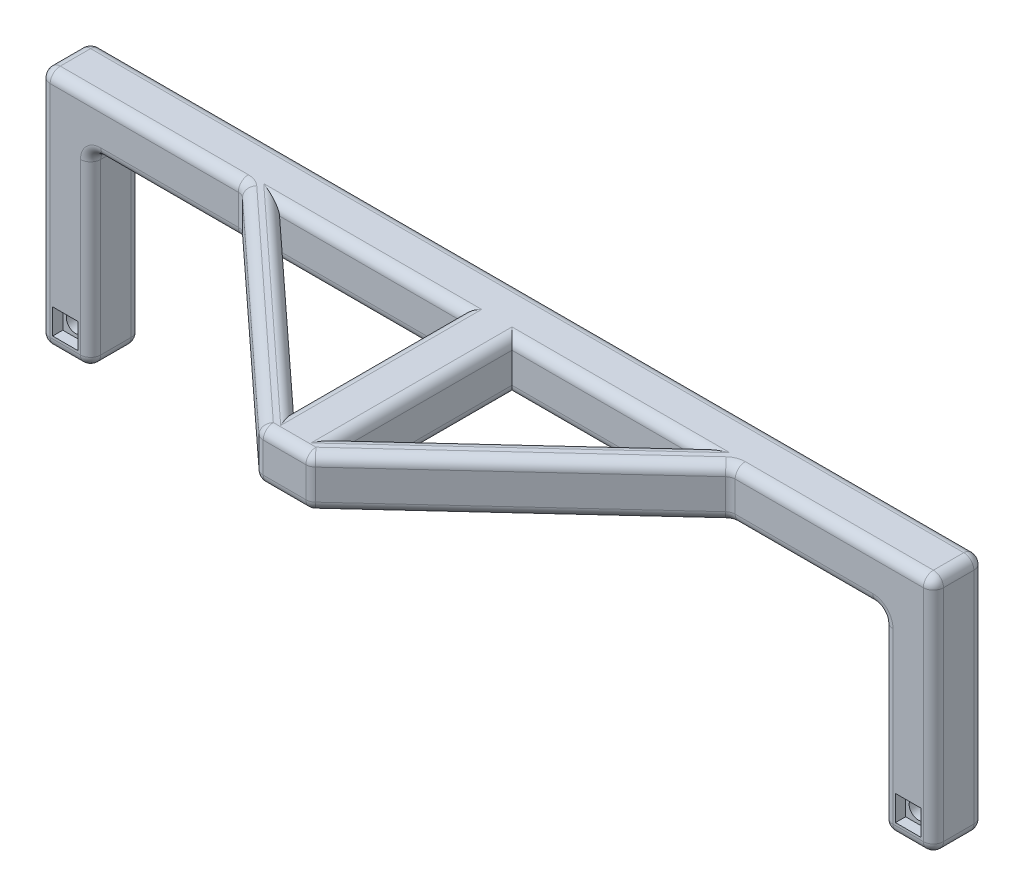
from build123d import *

# Parameters (mm, degrees)
SKETCH1_W           = 224.4725
SKETCH1_H           = 12.7
BOSS_EXTRUDE1_DEPTH = 12.7
SKETCH2_W           = 12.7
SKETCH2_H           = 12.7
BOSS_EXTRUDE2_DEPTH = 47.625
SKETCH3_R           = 2.286
CUT_EXTRUDE1_DEPTH  = 230.820220784
SKETCH4_W           = 6.35
SKETCH4_H           = 6.35
CUT_EXTRUDE2_DEPTH  = 2.54
BOSS_EXTRUDE3_DEPTH = 12.7
CUT_EXTRUDE4_DEPTH  = 12.7
FILLET1_R           = 2.54


with BuildPart() as part:
    # Sketch1 → Boss-Extrude1 (new body)
    with BuildSketch(Plane.XY):
        with Locations((112.23625, 6.35)):
            Rectangle(SKETCH1_W, SKETCH1_H)
    extrude(amount=BOSS_EXTRUDE1_DEPTH)

    # Sketch2 → Boss-Extrude2 (add)
    with BuildSketch(Plane.XZ):
        with Locations((6.35, 6.35)):
            Rectangle(SKETCH2_W, SKETCH2_H)
    boss_extrude2 = extrude(amount=BOSS_EXTRUDE2_DEPTH)

    # Sketch3 → Cut-Extrude1 (cut, through all)
    with BuildSketch(Plane.XY.offset(12.7)):
        with Locations((6.35, -41.275)):
            Circle(SKETCH3_R)
    cut_extrude1 = extrude(amount=-CUT_EXTRUDE1_DEPTH, mode=Mode.SUBTRACT)

    # Sketch4 → Cut-Extrude2 (cut)
    with BuildSketch(Plane.XY.offset(12.7)):
        with Locations((6.35, -41.275)):
            Rectangle(SKETCH4_W, SKETCH4_H)
    cut_extrude2 = extrude(amount=-CUT_EXTRUDE2_DEPTH, mode=Mode.SUBTRACT)

    # Mirror1: Boss-Extrude2, Cut-Extrude1, Cut-Extrude2 across plane
    add(boss_extrude2.mirror(Plane.ZY.offset(-112.23625)))
    add(cut_extrude1.mirror(Plane.ZY.offset(-112.23625)), mode=Mode.SUBTRACT)
    add(cut_extrude2.mirror(Plane.ZY.offset(-112.23625)), mode=Mode.SUBTRACT)

    # Sketch5 → Boss-Extrude3 (add)
    with BuildSketch(Plane(origin=(0, 12.7, 0), x_dir=(1, 0, 0), z_dir=(0, 1, 0))):
        Polygon((50.8, -12.7), (105.88625, -63.5), (118.58625, -63.5), (173.6725, -12.7), align=None)
    extrude(amount=-BOSS_EXTRUDE3_DEPTH)

    # Sketch7 → Cut-Extrude4 (cut)
    with BuildSketch(Plane(origin=(0, 12.7, 0), x_dir=(1, 0, 0), z_dir=(0, 1, 0))):
        Polygon((60.166775508, -12.7), (105.88625, -54.862051404), (105.88625, -12.7), align=None)
        Polygon((118.58625, -54.862051404), (118.58625, -12.7), (164.305724492, -12.7), align=None)
    extrude(amount=-CUT_EXTRUDE4_DEPTH, mode=Mode.SUBTRACT)

    # Fillet1
    fillet1_edges = [part.edges().sort_by_distance(p)[0] for p in [
        (12.7, -23.8125, 0),
        (12.7, -23.8125, 12.7),
        (211.7725, -23.8125, 12.7),
        (211.7725, -23.8125, 0),
        (0, -17.4625, 12.7),
        (0, -17.4625, 0),
        (224.4725, -17.4625, 12.7),
        (224.4725, -17.4625, 0),
        (218.1225, -47.625, 0),
        (211.7725, -47.625, 6.35),
        (218.1225, -47.625, 12.7),
        (224.4725, -47.625, 6.35),
        (6.35, -47.625, 12.7),
        (12.7, -47.625, 6.35),
        (6.35, -47.625, 0),
        (0, -47.625, 6.35),
        (12.7, 0, 6.35),
        (31.75, 0, 12.7),
        (192.7225, 0, 12.7),
        (211.7725, 0, 6.35),
        (112.23625, 0, 0),
        (141.445987246, 0, 12.7),
        (141.445987246, 0, 33.781025702),
        (118.58625, 0, 33.781025702),
        (83.026512754, 0, 33.781025702),
        (83.026512754, 0, 12.7),
        (105.88625, 0, 33.781025702),
        (78.343125, 0, 38.1),
        (50.8, 6.35, 12.7),
        (173.6725, 6.35, 12.7),
        (146.129375, 0, 38.1),
        (118.58625, 6.35, 63.5),
        (112.23625, 0, 63.5),
        (105.88625, 6.35, 63.5),
        (224.4725, 12.7, 6.35),
        (199.0725, 12.7, 12.7),
        (146.129375, 12.7, 38.1),
        (112.23625, 12.7, 63.5),
        (78.343125, 12.7, 38.1),
        (25.4, 12.7, 12.7),
        (0, 12.7, 6.35),
        (112.23625, 12.7, 0),
        (118.58625, 12.7, 33.781025702),
        (141.445987246, 12.7, 33.781025702),
        (141.445987246, 12.7, 12.7),
        (105.88625, 12.7, 33.781025702),
        (83.026512754, 12.7, 12.7),
        (83.026512754, 12.7, 33.781025702),
    ]]
    fillet(fillet1_edges, radius=FILLET1_R)


solid = part.part
